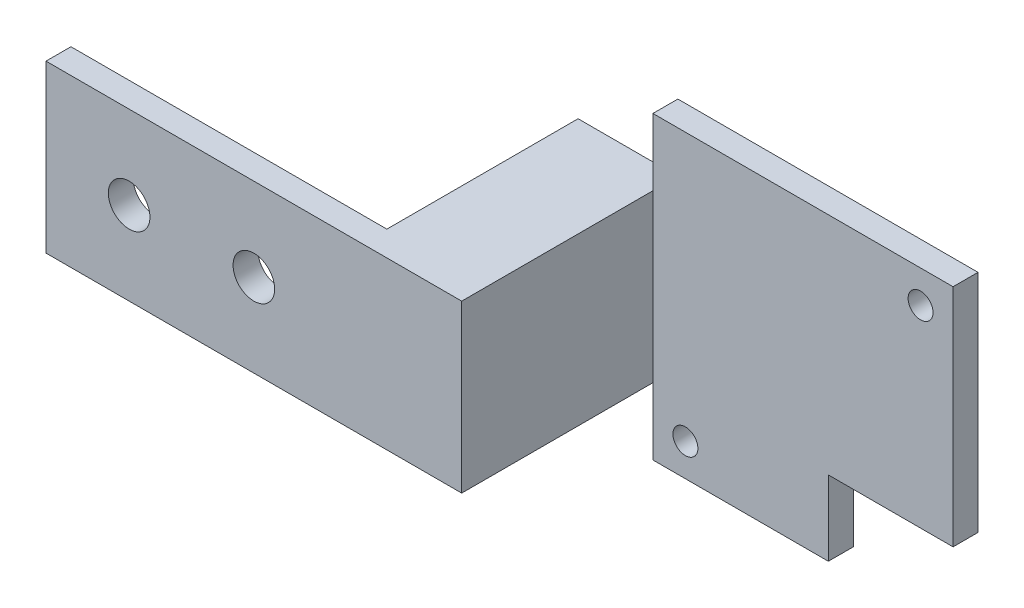
from build123d import *

# Parameters (mm, degrees)
SKETCH_1_W          = 36.1
SKETCH_1_H          = 36.1
EXTRUDE_1_DEPTH     = 3
SKETCH_2_R          = 1.5
CUT_EXTRUDE_1_DEPTH = 3
SKETCH_3_W          = 15
SKETCH_3_H          = 9
CUT_EXTRUDE_2_DEPTH = 3
SKETCH_4_W          = 12
SKETCH_4_H          = 20
EXTRUDE_2_DEPTH     = 3
SKETCH_5_W          = 12
SKETCH_5_H          = 20
EXTRUDE_3_DEPTH     = 20
SKETCH_7_W          = 50
SKETCH_7_H          = 20
EXTRUDE_4_DEPTH     = 3
SKETCH_9_R          = 2.5
CUT_EXTRUDE_4_DEPTH = 3


with BuildPart() as part:
    # 草图1 → 凸台-拉伸1 (new body)
    with BuildSketch(Plane.XY):
        Rectangle(SKETCH_1_W, SKETCH_1_H)
    extrude(amount=EXTRUDE_1_DEPTH)

    # 草图2 → 切除-拉伸1 (cut)
    with BuildSketch(Plane.XY.offset(3)):
        with Locations((14.142135624, 14.142135624)):
            Circle(SKETCH_2_R)
        with Locations((-14.142135624, -14.142135624)):
            Circle(SKETCH_2_R)
    extrude(amount=-CUT_EXTRUDE_1_DEPTH, mode=Mode.SUBTRACT)

    # 草图3 → 切除-拉伸2 (cut)
    with BuildSketch(Plane.XY.offset(3)):
        with Locations((10.55, -13.55)):
            Rectangle(SKETCH_3_W, SKETCH_3_H)
    extrude(amount=-CUT_EXTRUDE_2_DEPTH, mode=Mode.SUBTRACT)

    # 草图4 → 凸台-拉伸2 (add)
    with BuildSketch(Plane.XY.offset(3)):
        with Locations((-24.05, 0)):
            Rectangle(SKETCH_4_W, SKETCH_4_H)
    extrude(amount=-EXTRUDE_2_DEPTH)

    # 草图5 → 凸台-拉伸3 (add)
    with BuildSketch(Plane.XY.offset(3)):
        with Locations((-24.05, 0)):
            Rectangle(SKETCH_5_W, SKETCH_5_H)
    extrude(amount=EXTRUDE_3_DEPTH)

    # 草图7 → 凸台-拉伸4 (add)
    with BuildSketch(Plane.XY.offset(23)):
        with Locations((-43.05, 0)):
            Rectangle(SKETCH_7_W, SKETCH_7_H)
    extrude(amount=EXTRUDE_4_DEPTH)

    # 草图9 → 切除-拉伸4 (cut)
    with BuildSketch(Plane.XY.offset(26)):
        with Locations((-58.05, 0)):
            Circle(SKETCH_9_R)
        with Locations((-43.05, 0)):
            Circle(SKETCH_9_R)
    extrude(amount=-CUT_EXTRUDE_4_DEPTH, mode=Mode.SUBTRACT)


solid = part.part
